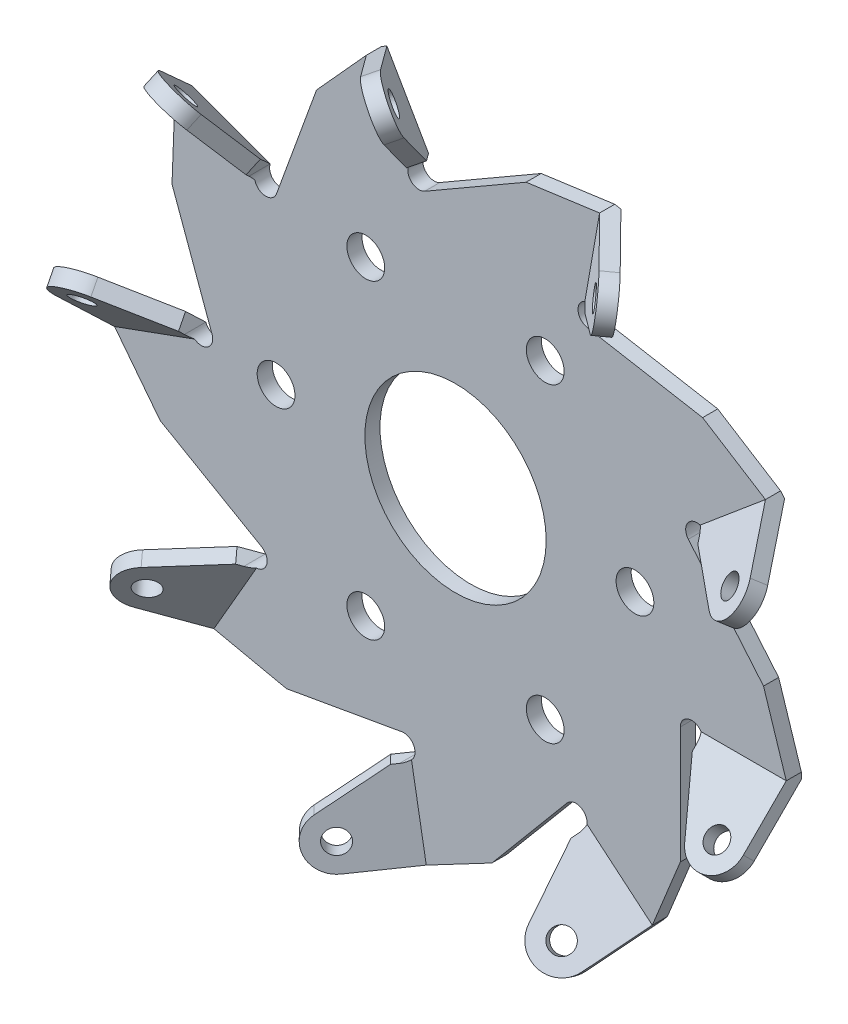
from build123d import *

# Parameters (mm, degrees)
SKETCH_7_R                          = 1.5
EXTRUDE_3_DEPTH                     = 2
PATTERN_CIRCULAR_1_COUNT            = 9
SKETCH_2_R                          = 50
SKETCH_2_R_2                        = 12
SKETCH_2_R_3                        = 2.5
EXTRUDE_1_DEPTH                     = 2
EXTRUDE_2_DEPTH                     = 2
SKETCH_4_R                          = 50
SKETCH_4_R_2                        = 46.106662127
CUT_EXTRUDE_1_DEPTH                 = 2
PATTERN_CIRCULAR_4_COUNT            = 9
OTHER_START                         = 25
OTHER_3_DEPTH                       = 7.880465325
CUT_EXTRUDE_4_REACH                 = 86.785
PATTERN_CIRCULAR_15_COUNT           = 9
CHAMFER_2_SIZE                      = 2
CUT_EXTRUDE_6_REACH                 = 86.785
PATTERN_CIRCULAR_17_COUNT           = 9
CUT_EXTRUDE_7_REACH                 = 86.785
PATTERN_CIRCULAR_19_COUNT           = 9
SKETCH_15_R                         = 8.026911935
CUT_EXTRUDE_9_DEPTH                 = 93.567160054
CUT_EXTRUDE_9_DRAFT                 = -5
PATTERN_CIRCULAR_26_COPY_1_SKETCH_R = 8.026911935
PATTERN_CIRCULAR_26_COPY_1_DEPTH    = 93.567160054
PATTERN_CIRCULAR_26_COPY_1_DRAFT    = -5
PATTERN_CIRCULAR_26_COPY_2_SKETCH_R = 8.026911935
PATTERN_CIRCULAR_26_COPY_2_DEPTH    = 93.567160054
PATTERN_CIRCULAR_26_COPY_2_DRAFT    = -5
PATTERN_CIRCULAR_26_COPY_3_SKETCH_R = 8.026911935
PATTERN_CIRCULAR_26_COPY_3_DEPTH    = 93.567160054
PATTERN_CIRCULAR_26_COPY_3_DRAFT    = -5
PATTERN_CIRCULAR_26_COPY_4_SKETCH_R = 8.026911935
PATTERN_CIRCULAR_26_COPY_4_DEPTH    = 93.567160054
PATTERN_CIRCULAR_26_COPY_4_DRAFT    = -5
PATTERN_CIRCULAR_26_COPY_5_SKETCH_R = 8.026911935
PATTERN_CIRCULAR_26_COPY_5_DEPTH    = 93.567160054
PATTERN_CIRCULAR_26_COPY_5_DRAFT    = -5
PATTERN_CIRCULAR_26_COPY_6_SKETCH_R = 8.026911935
PATTERN_CIRCULAR_26_COPY_6_DEPTH    = 93.567160054
PATTERN_CIRCULAR_26_COPY_6_DRAFT    = -5
PATTERN_CIRCULAR_26_COPY_7_SKETCH_R = 8.026911935
PATTERN_CIRCULAR_26_COPY_7_DEPTH    = 93.567160054
PATTERN_CIRCULAR_26_COPY_7_DRAFT    = -5
PATTERN_CIRCULAR_26_COPY_8_SKETCH_R = 8.026911935
PATTERN_CIRCULAR_26_COPY_8_DEPTH    = 93.567160054
PATTERN_CIRCULAR_26_COPY_8_DRAFT    = -5
SKETCH_14_R                         = 1.5
CUT_EXTRUDE_8_DEPTH                 = 82.855397957
PATTERN_CIRCULAR_27_COUNT           = 9
OTHER_START_2                       = 14.849242405
OTHER_4_OUTLINE_R                   = 2.5
OTHER_4_OUTLINE_R_2                 = 12
OTHER_4_DEPTH                       = 10.150757595


# Read off the part's stored shape, not the designer's step: 交差3, 交差4
with BuildPart() as part:
    # ｽｹｯﾁ1 → 回転1 (revolve)
    with BuildSketch(Plane(origin=(0, 0, 0), x_dir=(-1, 0, 0), z_dir=(0, 0.7071067811865488, 0.7071067811865464))):
        with BuildLine():
            Line((-47.157979176, 23.5), (-40.275, 23.5))
            Line((-40.275, 23.5), (-40.275, -23.5))
            Line((-40.275, -23.5), (-47.157979176, -23.5))
            add(Edge.make_bspline(
                [(-47.157979176, 23.5), (-53.013297933, 0), (-47.157979176, -23.5)],
                knots=[4.373605266, 4.373605266, 4.373605266, 5.051172695, 5.051172695, 5.051172695], degree=2, weights=[1, 0.943159584, 1]))
        make_face()
    revolve(axis=Axis((40.275, -16.617009358, 16.617009358), (0, 0.7071067811865462, -0.7071067811865489)))

    # ｽｹｯﾁ7 → ﾎﾞｽ - 押し出し3 (add)
    with BuildSketch(Plane(origin=(0, -16.617009358, 16.617009358), x_dir=(1, 0, 0), z_dir=(0, -0.7071067811865462, 0.7071067811865488))):
        with Locations(Location((40.275, 0, 0), (0, 0, 270))):
            Circle(SKETCH_7_R)
    extrude_3 = extrude(amount=EXTRUDE_3_DEPTH)

    # ﾐﾗｰ1: ﾎﾞｽ - 押し出し3 across plane
    add(extrude_3.mirror(Plane(origin=(0, 0, 0), x_dir=(0, 0.7071067811865488, 0.7071067811865464), z_dir=(0, -0.7071067811865462, 0.7071067811865488))))


with BuildPart() as pattern_circular_1_1:
    # 円形ﾊﾟﾀｰﾝ1: pattern copy
    add(part.part.rotate(Axis((0, 0, -25.842985085), (0, 0, 1)), 1 * 360 / PATTERN_CIRCULAR_1_COUNT))


with BuildPart() as pattern_circular_1_2:
    # 円形ﾊﾟﾀｰﾝ1: pattern copy
    add(part.part.rotate(Axis((0, 0, -25.842985085), (0, 0, 1)), 2 * 360 / PATTERN_CIRCULAR_1_COUNT))


with BuildPart() as pattern_circular_1_3:
    # 円形ﾊﾟﾀｰﾝ1: pattern copy
    add(part.part.rotate(Axis((0, 0, -25.842985085), (0, 0, 1)), 3 * 360 / PATTERN_CIRCULAR_1_COUNT))


with BuildPart() as pattern_circular_1_4:
    # 円形ﾊﾟﾀｰﾝ1: pattern copy
    add(part.part.rotate(Axis((0, 0, -25.842985085), (0, 0, 1)), 4 * 360 / PATTERN_CIRCULAR_1_COUNT))


with BuildPart() as pattern_circular_1_5:
    # 円形ﾊﾟﾀｰﾝ1: pattern copy
    add(part.part.rotate(Axis((0, 0, -25.842985085), (0, 0, 1)), 5 * 360 / PATTERN_CIRCULAR_1_COUNT))


with BuildPart() as pattern_circular_1_6:
    # 円形ﾊﾟﾀｰﾝ1: pattern copy
    add(part.part.rotate(Axis((0, 0, -25.842985085), (0, 0, 1)), 6 * 360 / PATTERN_CIRCULAR_1_COUNT))


with BuildPart() as pattern_circular_1_7:
    # 円形ﾊﾟﾀｰﾝ1: pattern copy
    add(part.part.rotate(Axis((0, 0, -25.842985085), (0, 0, 1)), 7 * 360 / PATTERN_CIRCULAR_1_COUNT))


with BuildPart() as pattern_circular_1_8:
    # 円形ﾊﾟﾀｰﾝ1: pattern copy
    add(part.part.rotate(Axis((0, 0, -25.842985085), (0, 0, 1)), 8 * 360 / PATTERN_CIRCULAR_1_COUNT))


with BuildPart() as body_10:
    # ｽｹｯﾁ2 → ﾎﾞｽ - 押し出し1 (new body)
    with BuildSketch(Plane.XY.offset(25)):
        Circle(SKETCH_2_R)
        Circle(SKETCH_2_R_2, mode=Mode.SUBTRACT)
        with Locations((-23.75, 0)):
            Circle(SKETCH_2_R_3, mode=Mode.SUBTRACT)
        with Locations((-11.875, 20.56810334)):
            Circle(SKETCH_2_R_3, mode=Mode.SUBTRACT)
        with Locations((11.875, 20.56810334)):
            Circle(SKETCH_2_R_3, mode=Mode.SUBTRACT)
        with Locations((23.75, 0)):
            Circle(SKETCH_2_R_3, mode=Mode.SUBTRACT)
        with Locations((11.875, -20.56810334)):
            Circle(SKETCH_2_R_3, mode=Mode.SUBTRACT)
        with Locations((-11.875, -20.56810334)):
            Circle(SKETCH_2_R_3, mode=Mode.SUBTRACT)
    extrude(amount=-EXTRUDE_1_DEPTH)

    # ｽｹｯﾁ3 → ﾎﾞｽ - 押し出し2 (add)
    with BuildSketch(Plane(origin=(0, -17.324116139, 17.324116139), x_dir=(1, 0, 0), z_dir=(0, -0.7071067811865462, 0.7071067811865488))):
        with BuildLine():
            Line((37.243911087, -1.75), (24.686542732, 20))
            Line((24.686542732, 20), (43.775, 20))
            Line((43.775, 20), (43.775, 0))
            ThreePointArc((43.775, 0), (41.180866658, -3.380740392), (37.243911087, -1.75))
        make_face()
    extrude_2 = extrude(amount=EXTRUDE_2_DEPTH)

    # ｽｹｯﾁ4 → ｶｯﾄ - 押し出し1 (cut)
    with BuildSketch(Plane.XY.offset(25)):
        Circle(SKETCH_4_R)
        Circle(SKETCH_4_R_2, mode=Mode.SUBTRACT)
    extrude(amount=-CUT_EXTRUDE_1_DEPTH, mode=Mode.SUBTRACT)

    # 円形ﾊﾟﾀｰﾝ4: ﾎﾞｽ - 押し出し2 ×9 about axis
    pattern_circular_4_axis = Axis((0, 0, 0), (0, 0, 1))
    for i in range(1, PATTERN_CIRCULAR_4_COUNT):
        add(extrude_2.rotate(pattern_circular_4_axis, i * 360 / PATTERN_CIRCULAR_4_COUNT))

    # Combine 1: union part, 円形ﾊﾟﾀｰﾝ1_1, 円形ﾊﾟﾀｰﾝ1_2, 円形ﾊﾟﾀｰﾝ1_3, 円形ﾊﾟﾀｰﾝ1_4, 円形ﾊﾟﾀｰﾝ1_6, 円形ﾊﾟﾀｰﾝ1_5, 円形ﾊﾟﾀｰﾝ1_8, 円形ﾊﾟﾀｰﾝ1_7
    add(part.part)
    add(pattern_circular_1_1.part)
    add(pattern_circular_1_2.part)
    add(pattern_circular_1_3.part)
    add(pattern_circular_1_4.part)
    add(pattern_circular_1_6.part)
    add(pattern_circular_1_5.part)
    add(pattern_circular_1_8.part)
    add(pattern_circular_1_7.part)

    # 交差3 outline → 交差3 (cut)
    with BuildSketch(Plane.XY.offset(OTHER_START)):
        Polygon((43.775, -15.932797006), (43.775, 15.932797006), (41.553437572, 18.58035201), (35.578933147, 25.700489122), (23.292190994, 40.343258223), (19.888559889, 40.943410219), (10.735088059, 42.55741427), (-8.08929304, 45.876660553), (-11.082396003, 44.148591752), (-19.131824039, 39.501252308), (-35.685706961, 29.943863546), (-36.867775638, 26.696156547), (-40.046743043, 17.962015384), (-46.58438199, 0), (-45.402313312, -3.247707001), (-42.223345907, -11.981848164), (-35.685706961, -29.943863547), (-32.692603997, -31.671932349), (-8.089293042, -45.876660554), (-4.685661934, -45.276508557), (4.467809896, -43.662504506), (23.292190995, -40.343258223), (25.513753423, -37.695703218), (31.488257848, -30.575566106), align=None)
    extrude(amount=OTHER_3_DEPTH, mode=Mode.SUBTRACT)

    # ｽｹｯﾁ9 → ｶｯﾄ - 押し出し4 (cut, up to next)
    with BuildSketch(Plane.XY.offset(25), mode=Mode.PRIVATE) as cut_extrude_4_sk1:
        with BuildLine():
            Line((43.775, -14.476659403), (32.753908888, -14.476659403))
            Line((32.753908888, -14.476659403), (32.753908888, -32.45005))
            ThreePointArc((32.753908888, -32.45005), (39.30558696, -24.101766039), (43.775, -14.476659403))
        make_face()
    cut_extrude_4_tool1 = extrude(cut_extrude_4_sk1.sketch, amount=-CUT_EXTRUDE_4_REACH, mode=Mode.PRIVATE) & body_10.part
    # ｽｹｯﾁ9 → ｶｯﾄ - 押し出し4 (cut, up to next)
    with BuildSketch(Plane.XY.offset(25), mode=Mode.PRIVATE) as cut_extrude_4_sk2:
        with BuildLine():
            Line((43.775, 14.476659403), (43.775, -14.476659403))
            ThreePointArc((43.775, -14.476659403), (45.520014428, -7.331615029), (46.106662127, 0))
            ThreePointArc((46.106662127, 0), (45.520014428, 7.331615029), (43.775, 14.476659403))
        make_face()
    cut_extrude_4_tool2 = extrude(cut_extrude_4_sk2.sketch, amount=-CUT_EXTRUDE_4_REACH, mode=Mode.PRIVATE) & body_10.part
    cut_extrude_4_1 = cut_extrude_4_tool1.solids().sort_by_distance((36.761282, -20.949139, 25))[0]
    add(cut_extrude_4_1, mode=Mode.SUBTRACT)
    cut_extrude_4_2 = cut_extrude_4_tool2.solids().sort_by_distance((44.709716, 0, 25))[0]
    add(cut_extrude_4_2, mode=Mode.SUBTRACT)
    cut_extrude_4 = cut_extrude_4_1 + cut_extrude_4_2  # ｶｯﾄ - 押し出し4 as one shape, for the pattern or mirror that repeats it

    # 円形ﾊﾟﾀｰﾝ15: ｶｯﾄ - 押し出し4 ×9 about axis
    pattern_circular_15_axis = Axis((0, 0, 0), (0, 0, 1))
    for i in range(1, PATTERN_CIRCULAR_15_COUNT):
        add(cut_extrude_4.rotate(pattern_circular_15_axis, i * 360 / PATTERN_CIRCULAR_15_COUNT), mode=Mode.SUBTRACT)

    # 面取り2
    chamfer_2_edges = [body_10.edges().sort_by_distance(p)[0] for p in [
        (-40.908134603, 0.516395821, 25),
        (-31.669382027, -25.899659909, 25),
        (-7.612173634, -40.196976925, 25),
        (20.006855402, -35.685681698, 25),
        (38.264454444, -14.476659403, 25),
        (38.61768999, 13.506152717, 25),
        (20.901279201, 35.169285877, 25),
        (-6.595072417, 40.376319312, 25),
        (-31.005516356, 26.690824208, 25),
    ]]
    chamfer(chamfer_2_edges, length=CHAMFER_2_SIZE - 0.0001)  # a hair under: the kernel refuses the full size

    # ｽｹｯﾁ11 → ｶｯﾄ - 押し出し6 (cut, up to next)
    with BuildSketch(Plane.XY.offset(25), mode=Mode.PRIVATE) as cut_extrude_6_sk1:
        with BuildLine():
            Line((-5.571850447, 34.604046872), (11.892264826, 44.686958525))
            ThreePointArc((11.892264826, 44.686958525), (13.941302931, 44.137920419), (13.392264826, 42.088882314))
            Line((13.392264826, 42.088882314), (-4.071850447, 32.00597066))
            ThreePointArc((-4.071850447, 32.00597066), (-6.120888552, 32.555008766), (-5.571850447, 34.604046872))
        make_face()
    cut_extrude_6_tool1 = extrude(cut_extrude_6_sk1.sketch, amount=-CUT_EXTRUDE_6_REACH, mode=Mode.PRIVATE) & body_10.part
    cut_extrude_6 = cut_extrude_6_tool1.solids().sort_by_distance((3.910207, 38.346465, 25))[0]
    add(cut_extrude_6, mode=Mode.SUBTRACT)

    # 円形ﾊﾟﾀｰﾝ17: ｶｯﾄ - 押し出し6 ×9 about axis
    pattern_circular_17_axis = Axis((0, 0, 0), (0, 0, 1))
    for i in range(1, PATTERN_CIRCULAR_17_COUNT):
        add(cut_extrude_6.rotate(pattern_circular_17_axis, i * 360 / PATTERN_CIRCULAR_17_COUNT), mode=Mode.SUBTRACT)

    # ｽｹｯﾁ13 → ｶｯﾄ - 押し出し7 (cut, up to next)
    with BuildSketch(Plane.XY.offset(25), mode=Mode.PRIVATE) as cut_extrude_7_sk1:
        Polygon((19.072718434, 41.08726508), (13.392264826, 42.088882314), (9.338467933, 39.748421587), align=None)
    cut_extrude_7_tool1 = extrude(cut_extrude_7_sk1.sketch, amount=-CUT_EXTRUDE_7_REACH, mode=Mode.PRIVATE) & body_10.part
    cut_extrude_7 = cut_extrude_7_tool1.solids().sort_by_distance((13.934484, 40.974856, 25))[0]
    add(cut_extrude_7, mode=Mode.SUBTRACT)

    # 円形ﾊﾟﾀｰﾝ19: ｶｯﾄ - 押し出し7 ×9 about axis
    pattern_circular_19_axis = Axis((0, 0, 0), (0, 0, 1))
    for i in range(1, PATTERN_CIRCULAR_19_COUNT):
        add(cut_extrude_7.rotate(pattern_circular_19_axis, i * 360 / PATTERN_CIRCULAR_19_COUNT), mode=Mode.SUBTRACT)


with BuildPart() as cut_extrude_9_tool:
    # ｽｹｯﾁ15 → ｶｯﾄ - 押し出し9 (with draft: the straight prism first)
    with BuildSketch(Plane(origin=(0, -17.324116139, 17.324116139), x_dir=(1, 0, 0), z_dir=(0, 0.7071067811865462, -0.7071067811865488))):
        with Locations((40.275, 0)):
            Circle(SKETCH_15_R)
    extrude(amount=CUT_EXTRUDE_9_DEPTH)
    # ｶｯﾄ - 押し出し9: the draft: its side faces are tilted about the plane it starts from
    cut_extrude_9_sides = [cut_extrude_9_tool.faces().sort_by_distance(p)[0] for p in [
        (32.248088065, 15.756870546, -15.756870546),
    ]]
    draft(cut_extrude_9_sides, Plane(origin=(0, -17.324116139, 17.324116139), x_dir=(1, 0, 0), z_dir=(0, 0.7071067811865462, -0.7071067811865488)), CUT_EXTRUDE_9_DRAFT)


with BuildPart() as body_10_1:
    add(body_10.part)

    # ｶｯﾄ - 押し出し9: cut by cut_extrude_9_tool
    add(cut_extrude_9_tool.part, mode=Mode.SUBTRACT)


with BuildPart() as pattern_circular_26_copy_1_tool:
    # 円形ﾊﾟﾀｰﾝ26 copy 1 sketch → 円形ﾊﾟﾀｰﾝ26 copy 1 (with draft: the straight prism first)
    with BuildSketch(Plane(origin=(11.135727203, -13.2710429, 17.324116139), x_dir=(0.766044443118978, 0.6427876096865393, 0), z_dir=(-0.4545194776720428, 0.5416752204197008, -0.7071067811865488))):
        with Locations((40.275, 0)):
            Circle(PATTERN_CIRCULAR_26_COPY_1_SKETCH_R)
    extrude(amount=PATTERN_CIRCULAR_26_COPY_1_DEPTH)
    # 円形ﾊﾟﾀｰﾝ26 copy 1: the draft: its side faces are tilted about the plane it starts from
    pattern_circular_26_copy_1_sides = [pattern_circular_26_copy_1_tool.faces().sort_by_distance(p)[0] for p in [
        (14.575147509, 32.799134567, -15.756870546),
    ]]
    draft(pattern_circular_26_copy_1_sides, Plane(origin=(11.135727203, -13.2710429, 17.324116139), x_dir=(0.766044443118978, 0.6427876096865393, 0), z_dir=(-0.4545194776720428, 0.5416752204197008, -0.7071067811865488)), PATTERN_CIRCULAR_26_COPY_1_DRAFT)


with BuildPart() as body_10_2:
    add(body_10_1.part)

    # 円形ﾊﾟﾀｰﾝ26 copy 1: cut by pattern_circular_26_copy_1_tool
    add(pattern_circular_26_copy_1_tool.part, mode=Mode.SUBTRACT)


with BuildPart() as pattern_circular_26_copy_2_tool:
    # 円形ﾊﾟﾀｰﾝ26 copy 2 sketch → 円形ﾊﾟﾀｰﾝ26 copy 2 (with draft: the straight prism first)
    with BuildSketch(Plane(origin=(17.060923888, -3.008301197, 17.324116139), x_dir=(0.17364817766693041, 0.984807753012208, 0), z_dir=(-0.6963642403200176, 0.12278780396897267, -0.7071067811865488))):
        with Locations((40.275, 0)):
            Circle(PATTERN_CIRCULAR_26_COPY_2_SKETCH_R)
    extrude(amount=PATTERN_CIRCULAR_26_COPY_2_DEPTH)
    # 円形ﾊﾟﾀｰﾝ26 copy 2: the draft: its side faces are tilted about the plane it starts from
    pattern_circular_26_copy_2_sides = [pattern_circular_26_copy_2_tool.faces().sort_by_distance(p)[0] for p in [
        (-9.917666551, 34.494319002, -15.756870546),
    ]]
    draft(pattern_circular_26_copy_2_sides, Plane(origin=(17.060923888, -3.008301197, 17.324116139), x_dir=(0.17364817766693041, 0.984807753012208, 0), z_dir=(-0.6963642403200176, 0.12278780396897267, -0.7071067811865488)), PATTERN_CIRCULAR_26_COPY_2_DRAFT)


with BuildPart() as body_10_3:
    add(body_10_2.part)

    # 円形ﾊﾟﾀｰﾝ26 copy 2: cut by pattern_circular_26_copy_2_tool
    add(pattern_circular_26_copy_2_tool.part, mode=Mode.SUBTRACT)


with BuildPart() as pattern_circular_26_copy_3_tool:
    # 円形ﾊﾟﾀｰﾝ26 copy 3 sketch → 円形ﾊﾟﾀｰﾝ26 copy 3 (with draft: the straight prism first)
    with BuildSketch(Plane(origin=(15.003124675, 8.66205807, 17.324116139), x_dir=(-0.4999999999999998, 0.8660254037844387, 0), z_dir=(-0.6123724356957935, -0.35355339059327295, -0.7071067811865488))):
        with Locations((40.275, 0)):
            Circle(PATTERN_CIRCULAR_26_COPY_3_SKETCH_R)
    extrude(amount=PATTERN_CIRCULAR_26_COPY_3_DEPTH)
    # 円形ﾊﾟﾀｰﾝ26 copy 3: the draft: its side faces are tilted about the plane it starts from
    pattern_circular_26_copy_3_sides = [pattern_circular_26_copy_3_tool.faces().sort_by_distance(p)[0] for p in [
        (-29.769894209, 20.049228215, -15.756870546),
    ]]
    draft(pattern_circular_26_copy_3_sides, Plane(origin=(15.003124675, 8.66205807, 17.324116139), x_dir=(-0.4999999999999998, 0.8660254037844387, 0), z_dir=(-0.6123724356957935, -0.35355339059327295, -0.7071067811865488)), PATTERN_CIRCULAR_26_COPY_3_DRAFT)


with BuildPart() as body_10_4:
    add(body_10_3.part)

    # 円形ﾊﾟﾀｰﾝ26 copy 3: cut by pattern_circular_26_copy_3_tool
    add(pattern_circular_26_copy_3_tool.part, mode=Mode.SUBTRACT)


with BuildPart() as pattern_circular_26_copy_4_tool:
    # 円形ﾊﾟﾀｰﾝ26 copy 4 sketch → 円形ﾊﾟﾀｰﾝ26 copy 4 (with draft: the straight prism first)
    with BuildSketch(Plane(origin=(5.925196685, 16.279344098, 17.324116139), x_dir=(-0.9396926207859083, 0.3420201433256689, 0), z_dir=(-0.24184476264797491, -0.6644630243886734, -0.7071067811865488))):
        with Locations((40.275, 0)):
            Circle(PATTERN_CIRCULAR_26_COPY_4_SKETCH_R)
    extrude(amount=PATTERN_CIRCULAR_26_COPY_4_DEPTH)
    # 円形ﾊﾟﾀｰﾝ26 copy 4: the draft: its side faces are tilted about the plane it starts from
    pattern_circular_26_copy_4_sides = [pattern_circular_26_copy_4_tool.faces().sort_by_distance(p)[0] for p in [
        (-35.692457512, -3.777119277, -15.756870546),
    ]]
    draft(pattern_circular_26_copy_4_sides, Plane(origin=(5.925196685, 16.279344098, 17.324116139), x_dir=(-0.9396926207859083, 0.3420201433256689, 0), z_dir=(-0.24184476264797491, -0.6644630243886734, -0.7071067811865488)), PATTERN_CIRCULAR_26_COPY_4_DRAFT)


with BuildPart() as body_10_5:
    add(body_10_4.part)

    # 円形ﾊﾟﾀｰﾝ26 copy 4: cut by pattern_circular_26_copy_4_tool
    add(pattern_circular_26_copy_4_tool.part, mode=Mode.SUBTRACT)


with BuildPart() as pattern_circular_26_copy_5_tool:
    # 円形ﾊﾟﾀｰﾝ26 copy 5 sketch → 円形ﾊﾟﾀｰﾝ26 copy 5 (with draft: the straight prism first)
    with BuildSketch(Plane(origin=(-5.925196685, 16.279344098, 17.324116139), x_dir=(-0.9396926207859084, -0.34202014332566866, 0), z_dir=(0.24184476264797478, -0.6644630243886736, -0.7071067811865488))):
        with Locations((40.275, 0)):
            Circle(PATTERN_CIRCULAR_26_COPY_5_SKETCH_R)
    extrude(amount=PATTERN_CIRCULAR_26_COPY_5_DEPTH)
    # 円形ﾊﾟﾀｰﾝ26 copy 5: the draft: its side faces are tilted about the plane it starts from
    pattern_circular_26_copy_5_sides = [pattern_circular_26_copy_5_tool.faces().sort_by_distance(p)[0] for p in [
        (-24.914123267, -25.836110681, -15.756870546),
    ]]
    draft(pattern_circular_26_copy_5_sides, Plane(origin=(-5.925196685, 16.279344098, 17.324116139), x_dir=(-0.9396926207859084, -0.34202014332566866, 0), z_dir=(0.24184476264797478, -0.6644630243886736, -0.7071067811865488)), PATTERN_CIRCULAR_26_COPY_5_DRAFT)


with BuildPart() as body_10_6:
    add(body_10_5.part)

    # 円形ﾊﾟﾀｰﾝ26 copy 5: cut by pattern_circular_26_copy_5_tool
    add(pattern_circular_26_copy_5_tool.part, mode=Mode.SUBTRACT)


with BuildPart() as pattern_circular_26_copy_6_tool:
    # 円形ﾊﾟﾀｰﾝ26 copy 6 sketch → 円形ﾊﾟﾀｰﾝ26 copy 6 (with draft: the straight prism first)
    with BuildSketch(Plane(origin=(-15.003124675, 8.66205807, 17.324116139), x_dir=(-0.5000000000000004, -0.8660254037844384, 0), z_dir=(0.6123724356957932, -0.35355339059327345, -0.7071067811865488))):
        with Locations((40.275, 0)):
            Circle(PATTERN_CIRCULAR_26_COPY_6_SKETCH_R)
    extrude(amount=PATTERN_CIRCULAR_26_COPY_6_DEPTH)
    # 円形ﾊﾟﾀｰﾝ26 copy 6: the draft: its side faces are tilted about the plane it starts from
    pattern_circular_26_copy_6_sides = [pattern_circular_26_copy_6_tool.faces().sort_by_distance(p)[0] for p in [
        (-2.478193856, -35.806098761, -15.756870546),
    ]]
    draft(pattern_circular_26_copy_6_sides, Plane(origin=(-15.003124675, 8.66205807, 17.324116139), x_dir=(-0.5000000000000004, -0.8660254037844384, 0), z_dir=(0.6123724356957932, -0.35355339059327345, -0.7071067811865488)), PATTERN_CIRCULAR_26_COPY_6_DRAFT)


with BuildPart() as body_10_7:
    add(body_10_6.part)

    # 円形ﾊﾟﾀｰﾝ26 copy 6: cut by pattern_circular_26_copy_6_tool
    add(pattern_circular_26_copy_6_tool.part, mode=Mode.SUBTRACT)


with BuildPart() as pattern_circular_26_copy_7_tool:
    # 円形ﾊﾟﾀｰﾝ26 copy 7 sketch → 円形ﾊﾟﾀｰﾝ26 copy 7 (with draft: the straight prism first)
    with BuildSketch(Plane(origin=(-17.060923888, -3.008301197, 17.324116139), x_dir=(0.17364817766692997, -0.9848077530122081, 0), z_dir=(0.6963642403200178, 0.12278780396897236, -0.7071067811865488))):
        with Locations((40.275, 0)):
            Circle(PATTERN_CIRCULAR_26_COPY_7_SKETCH_R)
    extrude(amount=PATTERN_CIRCULAR_26_COPY_7_DEPTH)
    # 円形ﾊﾟﾀｰﾝ26 copy 7: the draft: its side faces are tilted about the plane it starts from
    pattern_circular_26_copy_7_sides = [pattern_circular_26_copy_7_tool.faces().sort_by_distance(p)[0] for p in [
        (21.117310003, -29.02201529, -15.756870546),
    ]]
    draft(pattern_circular_26_copy_7_sides, Plane(origin=(-17.060923888, -3.008301197, 17.324116139), x_dir=(0.17364817766692997, -0.9848077530122081, 0), z_dir=(0.6963642403200178, 0.12278780396897236, -0.7071067811865488)), PATTERN_CIRCULAR_26_COPY_7_DRAFT)


with BuildPart() as body_10_8:
    add(body_10_7.part)

    # 円形ﾊﾟﾀｰﾝ26 copy 7: cut by pattern_circular_26_copy_7_tool
    add(pattern_circular_26_copy_7_tool.part, mode=Mode.SUBTRACT)


with BuildPart() as pattern_circular_26_copy_8_tool:
    # 円形ﾊﾟﾀｰﾝ26 copy 8 sketch → 円形ﾊﾟﾀｰﾝ26 copy 8 (with draft: the straight prism first)
    with BuildSketch(Plane(origin=(-11.135727203, -13.2710429, 17.324116139), x_dir=(0.7660444431189778, -0.6427876096865396, 0), z_dir=(0.45451947767204304, 0.5416752204197007, -0.7071067811865488))):
        with Locations((40.275, 0)):
            Circle(PATTERN_CIRCULAR_26_COPY_8_SKETCH_R)
    extrude(amount=PATTERN_CIRCULAR_26_COPY_8_DEPTH)
    # 円形ﾊﾟﾀｰﾝ26 copy 8: the draft: its side faces are tilted about the plane it starts from
    pattern_circular_26_copy_8_sides = [pattern_circular_26_copy_8_tool.faces().sort_by_distance(p)[0] for p in [
        (34.831789818, -8.658208322, -15.756870546),
    ]]
    draft(pattern_circular_26_copy_8_sides, Plane(origin=(-11.135727203, -13.2710429, 17.324116139), x_dir=(0.7660444431189778, -0.6427876096865396, 0), z_dir=(0.45451947767204304, 0.5416752204197007, -0.7071067811865488)), PATTERN_CIRCULAR_26_COPY_8_DRAFT)


with BuildPart() as body_10_9:
    add(body_10_8.part)

    # 円形ﾊﾟﾀｰﾝ26 copy 8: cut by pattern_circular_26_copy_8_tool
    add(pattern_circular_26_copy_8_tool.part, mode=Mode.SUBTRACT)

    # ｽｹｯﾁ14 → ｶｯﾄ - 押し出し8 (cut, through all)
    with BuildSketch(Plane(origin=(0, -18.738329701, 18.738329701), x_dir=(1, 0, 0), z_dir=(0, -0.7071067811865462, 0.7071067811865488))):
        with Locations(Location((40.275, 0, 0), (0, 0, 270))):
            Circle(SKETCH_14_R)
    cut_extrude_8 = extrude(amount=-CUT_EXTRUDE_8_DEPTH, mode=Mode.SUBTRACT)

    # 円形ﾊﾟﾀｰﾝ27: ｶｯﾄ - 押し出し8 ×9 about axis
    pattern_circular_27_axis = Axis((0, 0, -25.842985085), (0, 0, 1))
    for i in range(1, PATTERN_CIRCULAR_27_COUNT):
        add(cut_extrude_8.rotate(pattern_circular_27_axis, i * 360 / PATTERN_CIRCULAR_27_COUNT), mode=Mode.SUBTRACT)

    # ﾐﾗｰ2: body 10 across plane


with BuildPart() as body_10_10:
    add(body_10_9.part)
    add(body_10_9.part.mirror(Plane.XY.offset(25)))

    # 交差4 outline → 交差4 (cut)
    with BuildSketch(Plane.XY.offset(OTHER_START_2)):
        with BuildLine():
            Line((21.488829339, -42.492420955), (26.046256114, -37.061091223))
            Line((26.046256114, -37.061091223), (29.753908888, -27.961561256))
            Line((29.753908888, -27.961561256), (29.753908888, -12.476659403))
            ThreePointArc((29.753908888, -12.476659403), (31.253908888, -10.976659403), (32.753908888, -12.476659403))
            Line((32.753908888, -12.476659403), (32.753908888, -48))
            Line((32.753908888, -48), (43.775, -48))
            Line((43.775, -48), (43.775, -11.648232278))
            Line((43.775, -11.648232278), (40.766161688, -2.294354648))
            Line((40.766161688, -2.294354648), (30.812658639, 9.567768369))
            ThreePointArc((30.812658639, 9.567768369), (30.997543889, 11.681016448), (33.110791968, 11.496131198))
            Line((33.110791968, 11.496131198), (34.396367188, 9.964042311))
            Line((34.396367188, 9.964042311), (48, -6.248135965))
            Line((48, -6.248135965), (48, 10.897638077))
            Line((48, 10.897638077), (45.578361656, 13.783634273))
            Line((45.578361656, 13.783634273), (41.020934881, 19.214964005))
            Line((41.020934881, 19.214964005), (32.703474368, 24.446405998))
            Line((32.703474368, 24.446405998), (17.453822969, 27.135330987))
            ThreePointArc((17.453822969, 27.135330987), (16.237083605, 28.873014883), (17.974767502, 30.089754246))
            Line((17.974767502, 30.089754246), (19.944383008, 29.74245789))
            Line((19.944383008, 29.74245789), (48, 24.795495644))
            Line((48, 24.795495644), (48, 35.986604861))
            Line((48, 35.986604861), (26.055101346, 39.856082583))
            Line((26.055101346, 39.856082583), (19.072718434, 41.08726508))
            Line((19.072718434, 41.08726508), (9.338467933, 39.748421587))
            Line((9.338467933, 39.748421587), (-4.071850447, 32.00597066))
            ThreePointArc((-4.071850447, 32.00597066), (-6.120888552, 32.555008766), (-5.571850447, 34.604046872))
            Line((-5.571850447, 34.604046872), (-3.839799639, 35.604046872))
            Line((-3.839799639, 35.604046872), (19.3626718, 49))
            Line((19.3626718, 49), (-2.679510428, 49))
            Line((-2.679510428, 49), (-5.659630454, 47.279426901))
            Line((-5.659630454, 47.279426901), (-11.799834938, 43.73437819))
            Line((-11.799834938, 43.73437819), (-18.396111433, 36.45170896))
            Line((-18.396111433, 36.45170896), (-23.692259784, 21.900660955))
            ThreePointArc((-23.692259784, 21.900660955), (-25.61482893, 21.004152239), (-26.511337647, 22.926721385))
            Line((-26.511337647, 22.926721385), (-25.82729736, 24.806106627))
            Line((-25.82729736, 24.806106627), (-17.021440319, 49))
            Line((-17.021440319, 49), (-28.749840511, 49))
            Line((-28.749840511, 49), (-34.726158265, 32.58020192))
            Line((-34.726158265, 32.58020192), (-37.151114402, 25.917689691))
            Line((-37.151114402, 25.917689691), (-37.52294581, 16.098836596))
            Line((-37.52294581, 16.098836596), (-32.226797459, 1.547788591))
            ThreePointArc((-32.226797459, 1.547788591), (-33.123306175, -0.374780556), (-35.045875321, 0.521728161))
            Line((-35.045875321, 0.521728161), (-35.729915608, 2.401113402))
            Line((-35.729915608, 2.401113402), (-49, 38.860370594))
            Line((-49, 38.860370594), (-49, 6.636855936))
            Line((-49, 6.636855936), (-47.543930685, 2.636338372))
            Line((-47.543930685, 2.636338372), (-45.118974548, -4.026173857))
            Line((-45.118974548, -4.026173857), (-39.092376821, -11.786860331))
            Line((-39.092376821, -11.786860331), (-25.682058441, -19.529311257))
            ThreePointArc((-25.682058441, -19.529311257), (-25.133020336, -21.578349363), (-27.182058441, -22.127387469))
            Line((-27.182058441, -22.127387469), (-28.914109249, -21.127387469))
            Line((-28.914109249, -21.127387469), (-49, -9.53079304))
            Line((-49, -9.53079304), (-49, -22.256852877))
            Line((-49, -22.256852877), (-38.115369546, -28.5410972))
            Line((-38.115369546, -28.5410972), (-31.975165062, -32.086145912))
            Line((-31.975165062, -32.086145912), (-22.370050255, -34.157354312))
            Line((-22.370050255, -34.157354312), (-7.120398855, -31.468429324))
            ThreePointArc((-7.120398855, -31.468429324), (-5.382714959, -32.685168687), (-6.599454322, -34.422852583))
            Line((-6.599454322, -34.422852583), (-8.569069828, -34.770148938))
            Line((-8.569069828, -34.770148938), (-49, -41.899212776))
            Line((-49, -41.899212776), (-49, -48))
            Line((-49, -48), (-20.131349444, -48))
            Line((-20.131349444, -48), (-10.852203391, -46.363836193))
            Line((-10.852203391, -46.363836193), (-3.869820479, -45.132653696))
            Line((-3.869820479, -45.132653696), (4.819471442, -40.545242594))
            Line((4.819471442, -40.545242594), (14.77297449, -28.683119577))
            ThreePointArc((14.77297449, -28.683119577), (16.886222569, -28.498234327), (17.07110782, -30.611482406))
            Line((17.07110782, -30.611482406), (15.7855326, -32.143571292))
            Line((15.7855326, -32.143571292), (2.480409111, -48))
            Line((2.480409111, -48), (16.867421794, -48))
            Line((16.867421794, -48), (21.488829339, -42.492420955))
        make_face()
        with Locations((-11.875, -20.56810334)):
            Circle(OTHER_4_OUTLINE_R, mode=Mode.SUBTRACT)
        with Locations((-23.75, 0)):
            Circle(OTHER_4_OUTLINE_R, mode=Mode.SUBTRACT)
        with Locations((11.875, -20.56810334)):
            Circle(OTHER_4_OUTLINE_R, mode=Mode.SUBTRACT)
        Circle(OTHER_4_OUTLINE_R_2, mode=Mode.SUBTRACT)
        with Locations((23.75, 0)):
            Circle(OTHER_4_OUTLINE_R, mode=Mode.SUBTRACT)
        with Locations((-11.875, 20.56810334)):
            Circle(OTHER_4_OUTLINE_R, mode=Mode.SUBTRACT)
        with Locations((11.875, 20.56810334)):
            Circle(OTHER_4_OUTLINE_R, mode=Mode.SUBTRACT)
    extrude(amount=OTHER_4_DEPTH, mode=Mode.SUBTRACT)


solid = body_10_10.part
